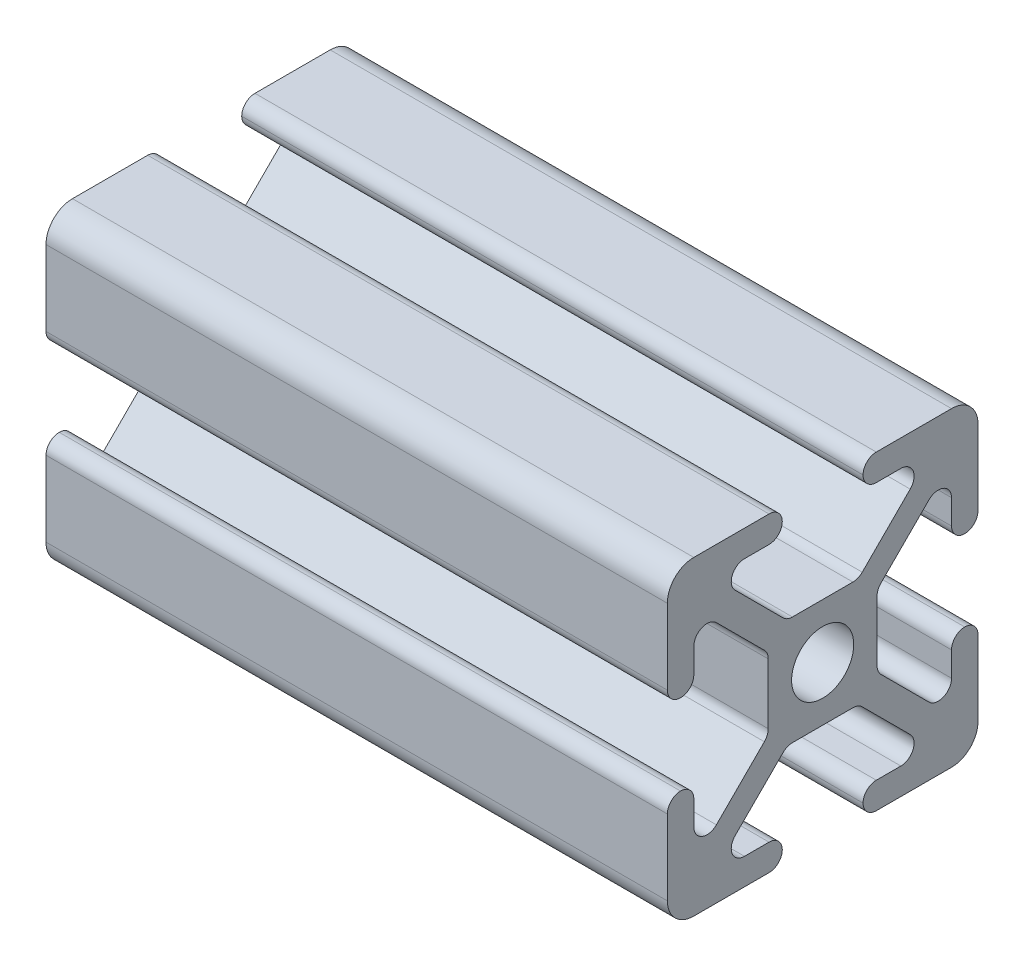
from build123d import *

# Parameters (mm, degrees)
SKETCH1_R           = 2.5
BOSS_EXTRUDE1_DEPTH = 50
FILLET1_R           = 1.065
FILLET2_R           = 2.13


with BuildPart() as part:
    # Sketch1 → Boss-Extrude1 (new body)
    with BuildSketch(Plane.YZ):
        Polygon((-12.5, -3.25), (-12.5, -12.5), (-3.25, -12.5), (-3.25, -10.37), (-8.863862556, -10.37), (-2.873862556, -4.38), (2.873862556, -4.38), (8.863862556, -10.37), (3.25, -10.37), (3.25, -12.5), (12.5, -12.5), (12.5, -3.25), (10.37, -3.25), (10.37, -8.863862556), (4.38, -2.873862556), (4.38, 2.873862556), (10.37, 8.863862556), (10.37, 3.25), (12.5, 3.25), (12.5, 12.5), (3.25, 12.5), (3.25, 10.37), (8.863862556, 10.37), (2.873862556, 4.38), (-2.873862556, 4.38), (-8.863862556, 10.37), (-3.25, 10.37), (-3.25, 12.5), (-12.5, 12.5), (-12.5, 3.25), (-10.37, 3.25), (-10.37, 8.863862556), (-4.38, 2.873862556), (-4.38, -2.873862556), (-10.37, -8.863862556), (-10.37, -3.25), align=None)
        with Locations(Location((0, 0, 0), (0, 0, 270))):
            Circle(SKETCH1_R, mode=Mode.SUBTRACT)
    extrude(amount=BOSS_EXTRUDE1_DEPTH)

    # Fillet1
    fillet1_edges = [part.edges().sort_by_distance(p)[0] for p in [
        (25, -10.37, -8.863862556),
        (25, 2.873862556, -4.38),
        (25, -2.873862556, -4.38),
        (25, -4.38, 2.873862556),
        (25, -4.38, -2.873862556),
        (25, -2.873862556, 4.38),
        (25, 2.873862556, 4.38),
        (25, 4.38, 2.873862556),
        (25, 4.38, -2.873862556),
        (25, -8.863862556, -10.37),
        (25, 8.863862556, -10.37),
        (25, 10.37, -8.863862556),
        (25, -10.37, 8.863862556),
        (25, -8.863862556, 10.37),
        (25, 10.37, 8.863862556),
        (25, 8.863862556, 10.37),
        (25, 12.5, 3.25),
        (25, -3.25, -12.5),
        (25, -10.37, 3.25),
        (25, 10.37, 3.25),
        (25, -10.37, -3.25),
        (25, -12.5, -3.25),
        (25, -12.5, 3.25),
        (25, 3.25, -10.37),
        (25, -3.25, -10.37),
        (25, 3.25, -12.5),
        (25, 10.37, -3.25),
        (25, 12.5, -3.25),
        (25, 3.25, 12.5),
        (25, 3.25, 10.37),
        (25, -3.25, 10.37),
        (25, -3.25, 12.5),
    ]]
    fillet(fillet1_edges, radius=FILLET1_R - 0.0001)  # a hair under: the kernel refuses the full size

    # Fillet2
    fillet2_edges = [part.edges().sort_by_distance(p)[0] for p in [
        (25, -12.5, 12.5),
        (25, 12.5, 12.5),
        (25, 12.5, -12.5),
        (25, -12.5, -12.5),
    ]]
    fillet(fillet2_edges, radius=FILLET2_R)


solid = part.part
